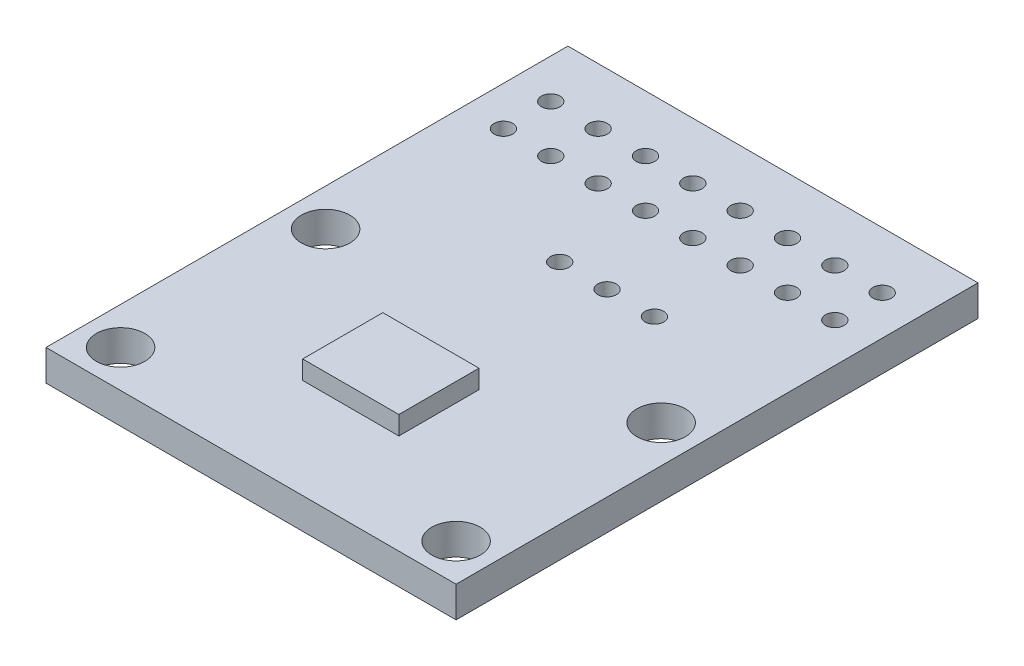
from build123d import *

# Parameters (mm, degrees)
SKETCH1_W                      = 22
SKETCH1_H                      = 28
BOSS_EXTRUDE1_DEPTH            = 1.66
SKETCH2_W                      = 5.16
SKETCH2_H                      = 4.3
BOSS_EXTRUDE2_DEPTH            = 1
F_2_6_2_6_DIAMETER_HOLE1_D     = 2.6
F_2_6_2_6_DIAMETER_HOLE1_DEPTH = 2.66
SKETCH6_R                      = 0.5
CUT_EXTRUDE1_DEPTH             = 18.881711327


with BuildPart() as part:
    # Sketch1 → Boss-Extrude1 (new body)
    with BuildSketch(Plane(origin=(0, 0.83, 0), x_dir=(1, 0, 0), z_dir=(0, 1, 0))):
        Rectangle(SKETCH1_W, SKETCH1_H)
    extrude(amount=-BOSS_EXTRUDE1_DEPTH)

    # Sketch2 → Boss-Extrude2 (add)
    with BuildSketch(Plane(origin=(0, 0.83, 0), x_dir=(-1, 0, 0), z_dir=(0, 1, 0))):
        with Locations((0, 6.5)):
            Rectangle(SKETCH2_W, SKETCH2_H)
    extrude(amount=BOSS_EXTRUDE2_DEPTH)

    # Ø2.6 (2.6) Diameter Hole1
    with Locations(Plane(origin=(0, -0.83, 0), x_dir=(-1, 0, 0), z_dir=(0, -1, 0))):
        with Locations((9, -1), (-9, -1), (9, -12), (-9, -12)):
            Hole(F_2_6_2_6_DIAMETER_HOLE1_D / 2, depth=F_2_6_2_6_DIAMETER_HOLE1_DEPTH)

    # Sketch6 → Cut-Extrude1 (cut, through all)
    with BuildSketch(Plane(origin=(0, 0.83, 0), x_dir=(1, 0, 0), z_dir=(0, 1, 0))):
        with Locations((-8.89, 10.97)):
            Circle(SKETCH6_R)
        with Locations((-8.89, 8.43)):
            Circle(SKETCH6_R)
        with Locations((-6.35, 10.97)):
            Circle(SKETCH6_R)
        with Locations((-6.35, 8.43)):
            Circle(SKETCH6_R)
        with Locations((-3.81, 10.97)):
            Circle(SKETCH6_R)
        with Locations((-3.81, 8.43)):
            Circle(SKETCH6_R)
        with Locations((-1.27, 10.97)):
            Circle(SKETCH6_R)
        with Locations((-1.27, 8.43)):
            Circle(SKETCH6_R)
        with Locations((1.27, 10.97)):
            Circle(SKETCH6_R)
        with Locations((1.27, 8.43)):
            Circle(SKETCH6_R)
        with Locations((3.81, 10.97)):
            Circle(SKETCH6_R)
        with Locations((3.81, 8.43)):
            Circle(SKETCH6_R)
        with Locations((6.35, 10.97)):
            Circle(SKETCH6_R)
        with Locations((6.35, 8.43)):
            Circle(SKETCH6_R)
        with Locations((8.89, 10.97)):
            Circle(SKETCH6_R)
        with Locations((8.89, 8.43)):
            Circle(SKETCH6_R)
        with Locations((-1.19, 3.75)):
            Circle(SKETCH6_R)
        with Locations((1.35, 3.75)):
            Circle(SKETCH6_R)
        with Locations((3.89, 3.75)):
            Circle(SKETCH6_R)
    extrude(amount=-CUT_EXTRUDE1_DEPTH, mode=Mode.SUBTRACT)


solid = part.part
